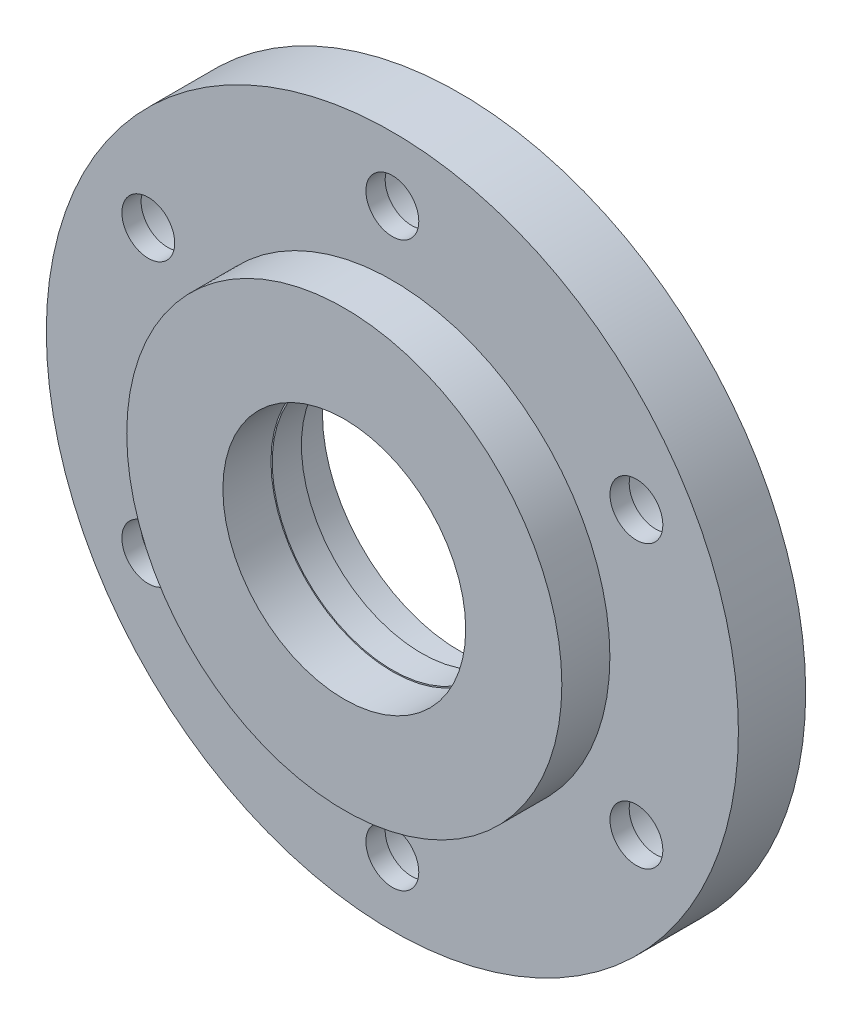
from build123d import *

# Parameters (mm, degrees)
SKETCH_CENTER_CUT_R            = 12.5
CUT_CENTER_DEPTH               = 52.39066063
CBORE_FOR_M5_SHCS2_D           = 5.5
CBORE_FOR_M5_SHCS2_CBORE_D     = 10
CBORE_FOR_M5_SHCS2_CBORE_DEPTH = 5
CIRPATTERN1_COUNT              = 6
SKETCH1_R                      = 14.2748
CUT_EXTRUDE1_DEPTH             = 3.9624


with BuildPart() as part:
    # Sketch Spindle Skeleton → Main Revolve (revolve)
    with BuildSketch(Plane(origin=(0, 0, 0), x_dir=(0, 0, -1), z_dir=(1, 0, 0))):
        Polygon((-20.873, 12.6312), (-20.873, 9.5), (-13.873, 9.5), (-13.873, 36), (-20.873, 36), (-20.873, 22.6312), (-25.873, 22.6312), (-25.873, 12.6312), align=None)
    revolve(axis=Axis((0, 0, 1000), (0, 0, -1)))

    # Sketch Center Cut → Cut Center (cut, through all)
    with BuildSketch(Plane.XY.offset(20.873)):
        Circle(SKETCH_CENTER_CUT_R)
    extrude(amount=-CUT_CENTER_DEPTH, mode=Mode.SUBTRACT)

    # CBORE for M5 SHCS2 (through all)
    with Locations(Plane(origin=(0, 0, 13.873), x_dir=(-1, 0, 0), z_dir=(0, 0, -1))):
        with Locations((0, 29.3156)):
            cbore_for_m5_shcs2 = CounterBoreHole(CBORE_FOR_M5_SHCS2_D / 2, CBORE_FOR_M5_SHCS2_CBORE_D / 2, CBORE_FOR_M5_SHCS2_CBORE_DEPTH)

    # CirPattern1: CBORE for M5 SHCS2 ×6 about axis
    cirpattern1_axis = Axis((0, 0, 13.873), (0, 0, 1))
    for i in range(1, CIRPATTERN1_COUNT):
        add(cbore_for_m5_shcs2.rotate(cirpattern1_axis, i * 360 / CIRPATTERN1_COUNT), mode=Mode.SUBTRACT)

    # Sketch1 → Cut-Extrude1 (cut)
    with BuildSketch(Plane(origin=(0, 0, 13.873), x_dir=(-1, 0, 0), z_dir=(0, 0, -1))):
        Circle(SKETCH1_R)
    extrude(amount=-CUT_EXTRUDE1_DEPTH, mode=Mode.SUBTRACT)


solid = part.part
